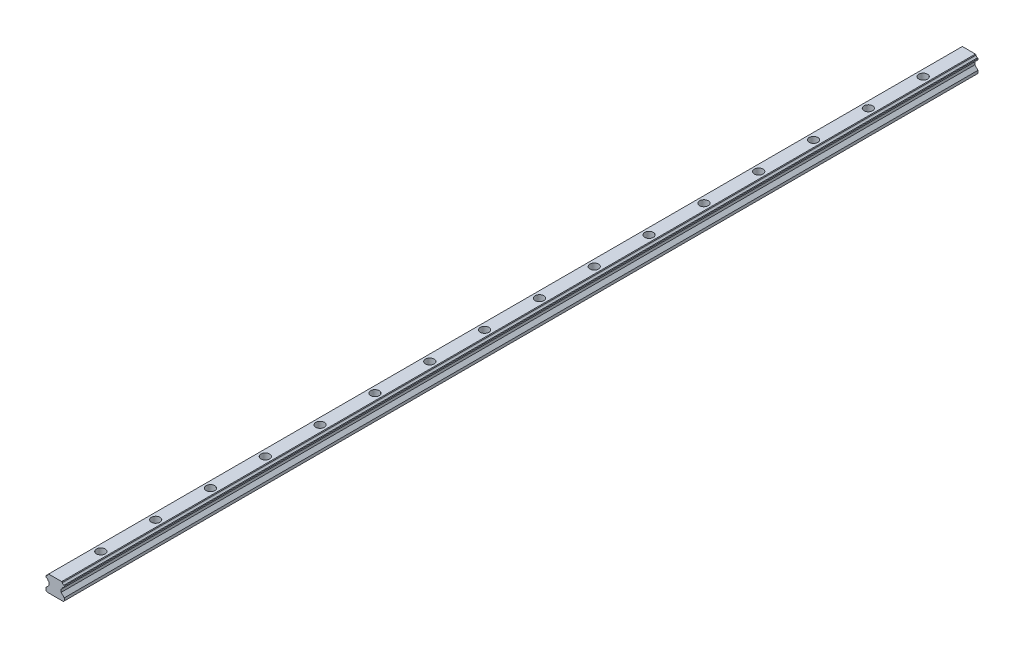
from build123d import *

# Parameters (mm, degrees)
BOSS_EXTRUDE1_DEPTH = 500
SKETCH2_R           = 3
CUT_EXTRUDE1_DEPTH  = 501.423820376
SKETCH3_R           = 4.75
CUT_EXTRUDE2_DEPTH  = 8.5
LPATTERN1_COUNT     = 100
LPATTERN1_PITCH     = 60


with BuildPart() as part:
    # Sketch1 → Boss-Extrude1 (new body)
    with BuildSketch(Plane.XY):
        with BuildLine():
            Line((-6.55, -4.115), (-6.55, -7.045))
            Line((-6.55, -7.045), (-10, -10.495))
            Line((-10, -10.495), (-10, -13.495))
            Line((-10, -13.495), (-9, -14.495))
            Line((-9, -14.495), (0, -14.495))
            Line((0, -14.495), (0, 3.505))
            Line((0, 3.505), (-7.16, 3.505))
            Line((-7.16, 3.505), (-7.768111832, 2.896888168))
            ThreePointArc((-7.768111832, 2.896888168), (-8.334356479, 1.761574733), (-9.469669914, 1.195330086))
            Line((-9.469669914, 1.195330086), (-10, 0.665))
            Line((-10, 0.665), (-10, -0.665))
            Line((-10, -0.665), (-9.469669914, -1.195330086))
            ThreePointArc((-9.469669914, -1.195330086), (-8.334356479, -1.761574733), (-7.768111832, -2.896888168))
            Line((-7.768111832, -2.896888168), (-6.55, -4.115))
        make_face()
    boss_extrude1 = extrude(amount=BOSS_EXTRUDE1_DEPTH)

    # Mirror1: Boss-Extrude1 across plane
    add(boss_extrude1.mirror(Plane(origin=(0, 3.505, 500), x_dir=(0, 0, 1), z_dir=(-1, 0, 0))))

    # Sketch2 → Cut-Extrude1 (cut, through all)
    with BuildSketch(Plane(origin=(0, 3.505, 0), x_dir=(1, 0, 0), z_dir=(0, 1, 0))):
        with Locations((0, -30)):
            Circle(SKETCH2_R)
    cut_extrude1 = extrude(amount=-CUT_EXTRUDE1_DEPTH, mode=Mode.SUBTRACT)

    # Sketch3 → Cut-Extrude2 (cut)
    with BuildSketch(Plane(origin=(0, 3.505, 0), x_dir=(1, 0, 0), z_dir=(0, 1, 0))):
        with Locations((0, -30)):
            Circle(SKETCH3_R)
    cut_extrude2 = extrude(amount=-CUT_EXTRUDE2_DEPTH, mode=Mode.SUBTRACT)

    # LPattern1: Cut-Extrude1, Cut-Extrude2 ×100
    with Locations(*[(0, 0, i * LPATTERN1_PITCH) for i in range(1, LPATTERN1_COUNT)]):
        add(cut_extrude1, mode=Mode.SUBTRACT)
        add(cut_extrude2, mode=Mode.SUBTRACT)

    # Mirror2: part across plane


with BuildPart() as part_1:
    add(part.part)
    add(part.part.mirror(Plane(origin=(-9.748570041, -3.175788295, 0), x_dir=(1, 0, 0), z_dir=(0, 0, -1))))


solid = part_1.part
